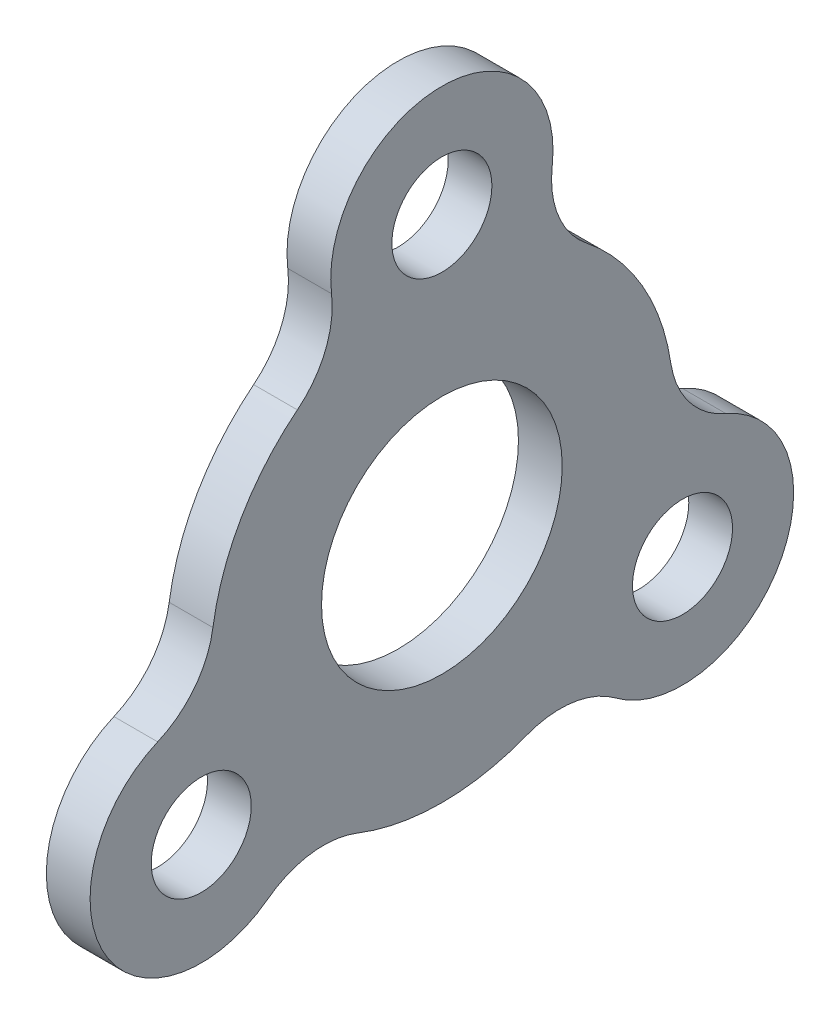
from build123d import *

# Parameters (mm, degrees)
SKETCH1_R           = 8.25000001
SKETCH1_R_2         = 3.429
BOSS_EXTRUDE1_DEPTH = 3


with BuildPart() as part:
    # Sketch1 → Boss-Extrude1 (new body)
    with BuildSketch(Plane(origin=(0, 0, 0), x_dir=(0, 0, -1), z_dir=(1, 0, 0))):
        with BuildLine():
            ThreePointArc((-9.90591589, 12.405178571), (-13.748153285, 7.9375), (-15.696157726, 2.376185522))
            ThreePointArc((-15.696157726, 2.376185522), (-16.954650538, -0.562093076), (-19.48514951, -2.515003783))
            ThreePointArc((-19.48514951, -2.515003783), (-23.096897519, -13.335), (-11.920631922, -15.617132581))
            ThreePointArc((-11.920631922, -15.617132581), (-8.964112152, -14.40211154), (-5.790241837, -14.781364094))
            ThreePointArc((-5.790241837, -14.781364094), (0, -15.875), (5.790241837, -14.781364094))
            ThreePointArc((5.790241837, -14.781364094), (8.964112152, -14.40211154), (11.920631922, -15.617132581))
            ThreePointArc((11.920631922, -15.617132581), (23.096897519, -13.335), (19.48514951, -2.515003783))
            ThreePointArc((19.48514951, -2.515003783), (16.954650538, -0.562093076), (15.696157726, 2.376185522))
            ThreePointArc((15.696157726, 2.376185522), (13.748153285, 7.9375), (9.90591589, 12.405178571))
            ThreePointArc((9.90591589, 12.405178571), (7.990538386, 14.964204616), (7.564517588, 18.132136364))
            ThreePointArc((7.564517588, 18.132136364), (0, 26.67), (-7.564517588, 18.132136364))
            ThreePointArc((-7.564517588, 18.132136364), (-7.990538386, 14.964204616), (-9.90591589, 12.405178571))
        make_face()
        Circle(SKETCH1_R, mode=Mode.SUBTRACT)
        with Locations((0, 19.05)):
            Circle(SKETCH1_R_2, mode=Mode.SUBTRACT)
        with Locations((-16.497783942, -9.525)):
            Circle(SKETCH1_R_2, mode=Mode.SUBTRACT)
        with Locations((16.497783942, -9.525)):
            Circle(SKETCH1_R_2, mode=Mode.SUBTRACT)
    extrude(amount=BOSS_EXTRUDE1_DEPTH)


solid = part.part
